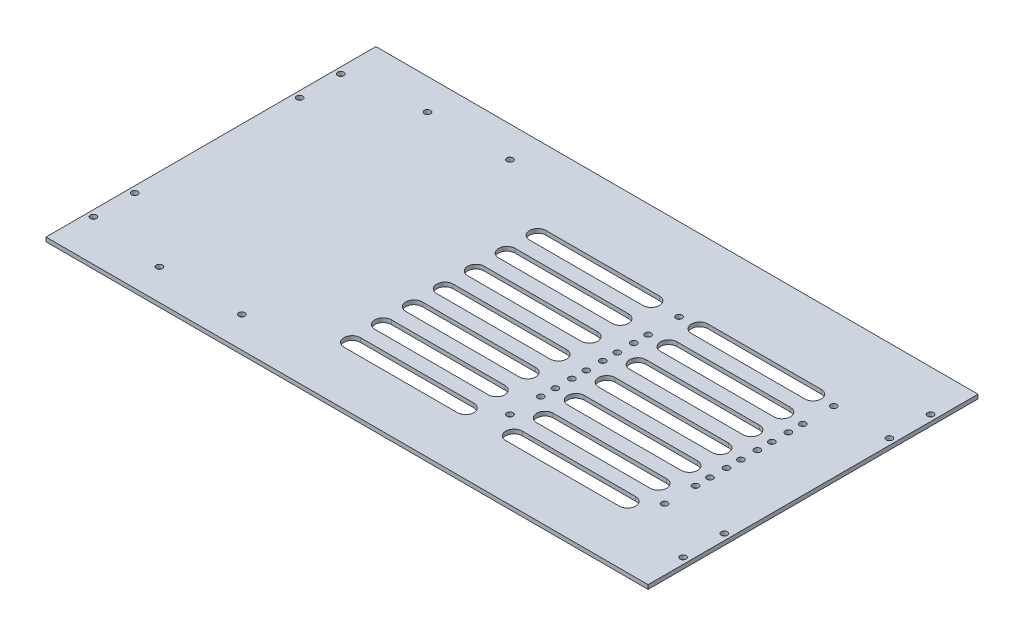
from build123d import *

# Parameters (mm, degrees)
SKETCH_1_W      = 292
SKETCH_1_H      = 160
SKETCH_1_R      = 1.5
EXTRUDE_1_DEPTH = 2


with BuildPart() as part:
    # 草图1 → 凸台-拉伸1 (new body)
    with BuildSketch(Plane(origin=(0, 0, 0), x_dir=(1, 0, 0), z_dir=(0, 1, 0))):
        with Locations((146, 80)):
            Rectangle(SKETCH_1_W, SKETCH_1_H)
        with Locations((3, 140)):
            Circle(SKETCH_1_R, mode=Mode.SUBTRACT)
        with Locations((3, 120)):
            Circle(SKETCH_1_R, mode=Mode.SUBTRACT)
        with Locations((3, 40)):
            Circle(SKETCH_1_R, mode=Mode.SUBTRACT)
        with Locations((3, 20)):
            Circle(SKETCH_1_R, mode=Mode.SUBTRACT)
        with Locations((289, 20)):
            Circle(SKETCH_1_R, mode=Mode.SUBTRACT)
        with Locations((289, 40)):
            Circle(SKETCH_1_R, mode=Mode.SUBTRACT)
        with Locations((289, 120)):
            Circle(SKETCH_1_R, mode=Mode.SUBTRACT)
        with Locations((289, 140)):
            Circle(SKETCH_1_R, mode=Mode.SUBTRACT)
        with Locations((187, 120)):
            Circle(SKETCH_1_R, mode=Mode.SUBTRACT)
        with Locations((262, 120)):
            Circle(SKETCH_1_R, mode=Mode.SUBTRACT)
        with Locations((262, 98)):
            Circle(SKETCH_1_R, mode=Mode.SUBTRACT)
        with Locations((187, 98)):
            Circle(SKETCH_1_R, mode=Mode.SUBTRACT)
        with Locations((187, 105)):
            Circle(SKETCH_1_R, mode=Mode.SUBTRACT)
        with Locations((262, 105)):
            Circle(SKETCH_1_R, mode=Mode.SUBTRACT)
        with Locations((187, 83)):
            Circle(SKETCH_1_R, mode=Mode.SUBTRACT)
        with Locations((262, 83)):
            Circle(SKETCH_1_R, mode=Mode.SUBTRACT)
        with Locations((187, 90)):
            Circle(SKETCH_1_R, mode=Mode.SUBTRACT)
        with Locations((262, 90)):
            Circle(SKETCH_1_R, mode=Mode.SUBTRACT)
        with Locations((187, 68)):
            Circle(SKETCH_1_R, mode=Mode.SUBTRACT)
        with Locations((262, 68)):
            Circle(SKETCH_1_R, mode=Mode.SUBTRACT)
        with Locations((187, 75)):
            Circle(SKETCH_1_R, mode=Mode.SUBTRACT)
        with Locations((262, 75)):
            Circle(SKETCH_1_R, mode=Mode.SUBTRACT)
        with Locations((187, 53)):
            Circle(SKETCH_1_R, mode=Mode.SUBTRACT)
        with Locations((262, 53)):
            Circle(SKETCH_1_R, mode=Mode.SUBTRACT)
        with Locations((187, 60)):
            Circle(SKETCH_1_R, mode=Mode.SUBTRACT)
        with Locations((262, 60)):
            Circle(SKETCH_1_R, mode=Mode.SUBTRACT)
        with Locations((187, 38)):
            Circle(SKETCH_1_R, mode=Mode.SUBTRACT)
        with Locations((262, 38)):
            Circle(SKETCH_1_R, mode=Mode.SUBTRACT)
        with Locations((40, 145)):
            Circle(SKETCH_1_R, mode=Mode.SUBTRACT)
        with Locations((80, 145)):
            Circle(SKETCH_1_R, mode=Mode.SUBTRACT)
        with Locations((40, 15)):
            Circle(SKETCH_1_R, mode=Mode.SUBTRACT)
        with Locations((80, 15)):
            Circle(SKETCH_1_R, mode=Mode.SUBTRACT)
        with BuildLine():
            Line((197, 124), (252, 124))
            ThreePointArc((252, 124), (256, 120), (252, 116))
            Line((252, 116), (197, 116))
            ThreePointArc((197, 116), (193, 120), (197, 124))
        make_face(mode=Mode.SUBTRACT)
        with BuildLine():
            Line((197, 101), (252, 101))
            ThreePointArc((252, 101), (256, 105), (252, 109))
            Line((252, 109), (197, 109))
            ThreePointArc((197, 109), (193, 105), (197, 101))
        make_face(mode=Mode.SUBTRACT)
        with BuildLine():
            Line((197, 86), (252, 86))
            ThreePointArc((252, 86), (256, 90), (252, 94))
            Line((252, 94), (197, 94))
            ThreePointArc((197, 94), (193, 90), (197, 86))
        make_face(mode=Mode.SUBTRACT)
        with BuildLine():
            Line((197, 71), (252, 71))
            ThreePointArc((252, 71), (256, 75), (252, 79))
            Line((252, 79), (197, 79))
            ThreePointArc((197, 79), (193, 75), (197, 71))
        make_face(mode=Mode.SUBTRACT)
        with BuildLine():
            Line((197, 56), (252, 56))
            ThreePointArc((252, 56), (256, 60), (252, 64))
            Line((252, 64), (197, 64))
            ThreePointArc((197, 64), (193, 60), (197, 56))
        make_face(mode=Mode.SUBTRACT)
        with BuildLine():
            Line((197, 49), (252, 49))
            ThreePointArc((252, 49), (256, 45), (252, 41))
            Line((252, 41), (197, 41))
            ThreePointArc((197, 41), (193, 45), (197, 49))
        make_face(mode=Mode.SUBTRACT)
        with BuildLine():
            Line((197, 34), (252, 34))
            ThreePointArc((252, 34), (256, 30), (252, 26))
            Line((252, 26), (197, 26))
            ThreePointArc((197, 26), (193, 30), (197, 34))
        make_face(mode=Mode.SUBTRACT)
        with BuildLine():
            Line((118.5, 116), (173.5, 116))
            ThreePointArc((173.5, 116), (177.5, 120), (173.5, 124))
            Line((173.5, 124), (118.5, 124))
            ThreePointArc((118.5, 124), (114.5, 120), (118.5, 116))
        make_face(mode=Mode.SUBTRACT)
        with BuildLine():
            Line((118.5, 109), (173.5, 109))
            ThreePointArc((173.5, 109), (177.5, 105), (173.5, 101))
            Line((173.5, 101), (118.5, 101))
            ThreePointArc((118.5, 101), (114.5, 105), (118.5, 109))
        make_face(mode=Mode.SUBTRACT)
        with BuildLine():
            Line((118.5, 94), (173.5, 94))
            ThreePointArc((173.5, 94), (177.5, 90), (173.5, 86))
            Line((173.5, 86), (118.5, 86))
            ThreePointArc((118.5, 86), (114.5, 90), (118.5, 94))
        make_face(mode=Mode.SUBTRACT)
        with BuildLine():
            Line((118.5, 79), (173.5, 79))
            ThreePointArc((173.5, 79), (177.5, 75), (173.5, 71))
            Line((173.5, 71), (118.5, 71))
            ThreePointArc((118.5, 71), (114.5, 75), (118.5, 79))
        make_face(mode=Mode.SUBTRACT)
        with BuildLine():
            Line((118.5, 64), (173.5, 64))
            ThreePointArc((173.5, 64), (177.5, 60), (173.5, 56))
            Line((173.5, 56), (118.5, 56))
            ThreePointArc((118.5, 56), (114.5, 60), (118.5, 64))
        make_face(mode=Mode.SUBTRACT)
        with BuildLine():
            Line((118.5, 49), (173.5, 49))
            ThreePointArc((173.5, 49), (177.5, 45), (173.5, 41))
            Line((173.5, 41), (118.5, 41))
            ThreePointArc((118.5, 41), (114.5, 45), (118.5, 49))
        make_face(mode=Mode.SUBTRACT)
        with BuildLine():
            Line((118.5, 34), (173.5, 34))
            ThreePointArc((173.5, 34), (177.5, 30), (173.5, 26))
            Line((173.5, 26), (118.5, 26))
            ThreePointArc((118.5, 26), (114.5, 30), (118.5, 34))
        make_face(mode=Mode.SUBTRACT)
    extrude(amount=EXTRUDE_1_DEPTH)


solid = part.part
